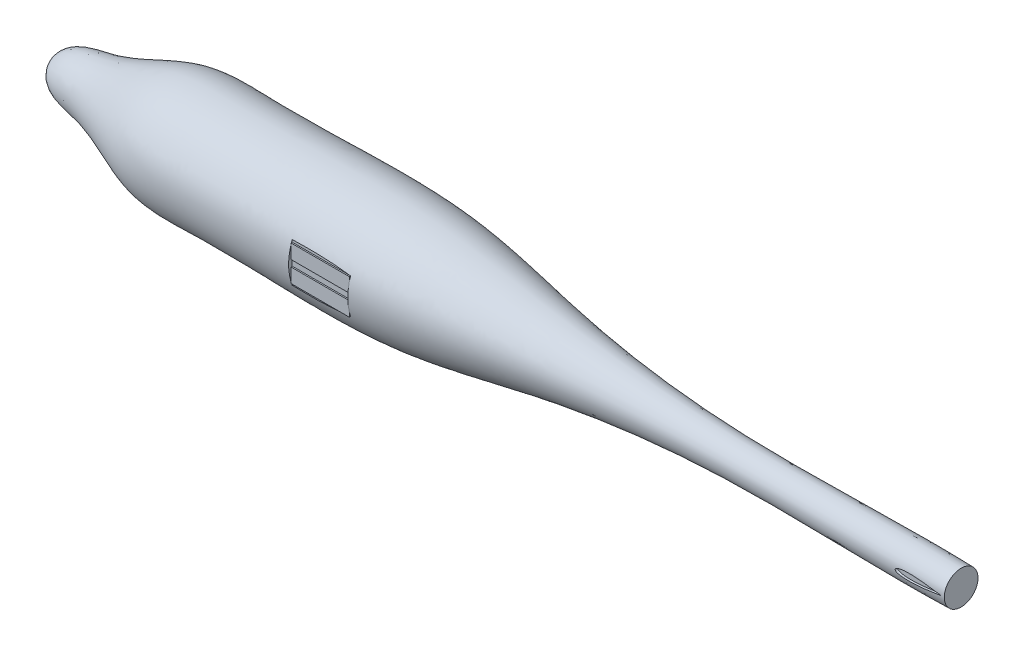
from build123d import *

# Parameters (mm, degrees)
SKETCH5_W           = 90
SKETCH5_H           = 200
CUT_EXTRUDE4_DEPTH  = 6.5
SKETCH8_W           = 90
SKETCH8_H           = 22.045196906
BOSS_EXTRUDE1_DEPTH = 2
CUT_EXTRUDE7_DEPTH  = 65


with BuildPart() as part:
    # Sketch1 → Revolve2 (revolve)
    with BuildSketch(Plane.XY):
        with BuildLine():
            Line((0, 0), (1400, 0))
            Line((1400, 0), (1400, 25.997014576))
            add(Edge.make_bspline(
                [(0, 0), (6.007862839, 35.12054136), (87.570445438, 35.979993634), (174.285504865, 89.884927882), (355.229810131, 80.463468301), (551.199038272, 98.190296267), (802.566829119, 43.065619564), (1072.41205954, 17.747902618), (1281.149711777, 28.859320036), (1400, 25.997014576)],
                knots=[0, 0, 0, 0, 0.060908752, 0.147322495, 0.213188607, 0.431416814, 0.561861324, 0.750119802, 1, 1, 1, 1], degree=3))
        make_face()
    revolve(axis=Axis((0, 0, 0), (1, 0, 0)))

    # Sketch5 → Cut-Extrude4 (cut)
    with BuildSketch(Plane.XY.offset(88)):
        with Locations((495, 0)):
            Rectangle(SKETCH5_W, SKETCH5_H)
    extrude(amount=-CUT_EXTRUDE4_DEPTH, mode=Mode.SUBTRACT)

    # Sketch8 → Boss-Extrude1 (add)
    with BuildSketch(Plane.XY.offset(81.5)):
        with Locations((495, 16.022598453)):
            Rectangle(SKETCH8_W, SKETCH8_H)
        with Locations((495, -16.022598453)):
            Rectangle(SKETCH8_W, SKETCH8_H)
    extrude(amount=BOSS_EXTRUDE1_DEPTH)

    # Sketch14 → Cut-Extrude7 (cut)
    with BuildSketch(Plane.XY.offset(88)):
        with BuildLine():
            Line((1395, 0.1106), (1395, -0.1106))
            add(Edge.make_bspline(
                [(1395, 0.1106), (1393.833719765, 0.311248034), (1391.502958358, 0.71223459), (1386.838701983, 1.457697445), (1381.007945313, 2.313489836), (1374.007359143, 3.225234898), (1367.007451257, 4.016115554), (1360.007467218, 4.662521544), (1353.00637342, 5.121735703), (1347.167337009, 5.283386722), (1342.498027895, 5.219716763), (1338.994113971, 5.046557174), (1335.48539919, 4.713356984), (1332.564294915, 4.246864191), (1330.231412395, 3.692167034), (1328.460126262, 3.135915045), (1326.971024707, 2.460799027), (1325.634330615, 1.567456435), (1324.597415043, 0), (1325.634330615, -1.567456435), (1326.971024707, -2.460799027), (1328.460126262, -3.135915045), (1330.231412395, -3.692167034), (1332.564294915, -4.246864191), (1335.48539919, -4.713356984), (1338.994113971, -5.046557174), (1342.498027895, -5.219716763), (1347.167337009, -5.283386722), (1353.00637342, -5.121735703), (1360.007467218, -4.662521544), (1367.007451257, -4.016115554), (1374.007359143, -3.225234898), (1381.007945313, -2.313489836), (1386.838701983, -1.457697445), (1391.502958358, -0.71223459), (1393.833719765, -0.311248034), (1395, -0.1106)],
                knots=[0, 0, 0, 0, 0.024684023, 0.04932997, 0.098522081, 0.147602022, 0.196578276, 0.24545048, 0.2942189, 0.342903642, 0.367241268, 0.391607784, 0.416059249, 0.440726349, 0.453242725, 0.466028387, 0.479472724, 0.486972137, 0.5, 0.513027863, 0.520527276, 0.533971613, 0.546757275, 0.559273651, 0.583940751, 0.608392216, 0.632758732, 0.657096358, 0.7057811, 0.75454952, 0.803421724, 0.852397978, 0.901477919, 0.95067003, 0.975315977, 1, 1, 1, 1], degree=3))
        make_face()
    extrude(amount=-CUT_EXTRUDE7_DEPTH, mode=Mode.SUBTRACT)


solid = part.part
